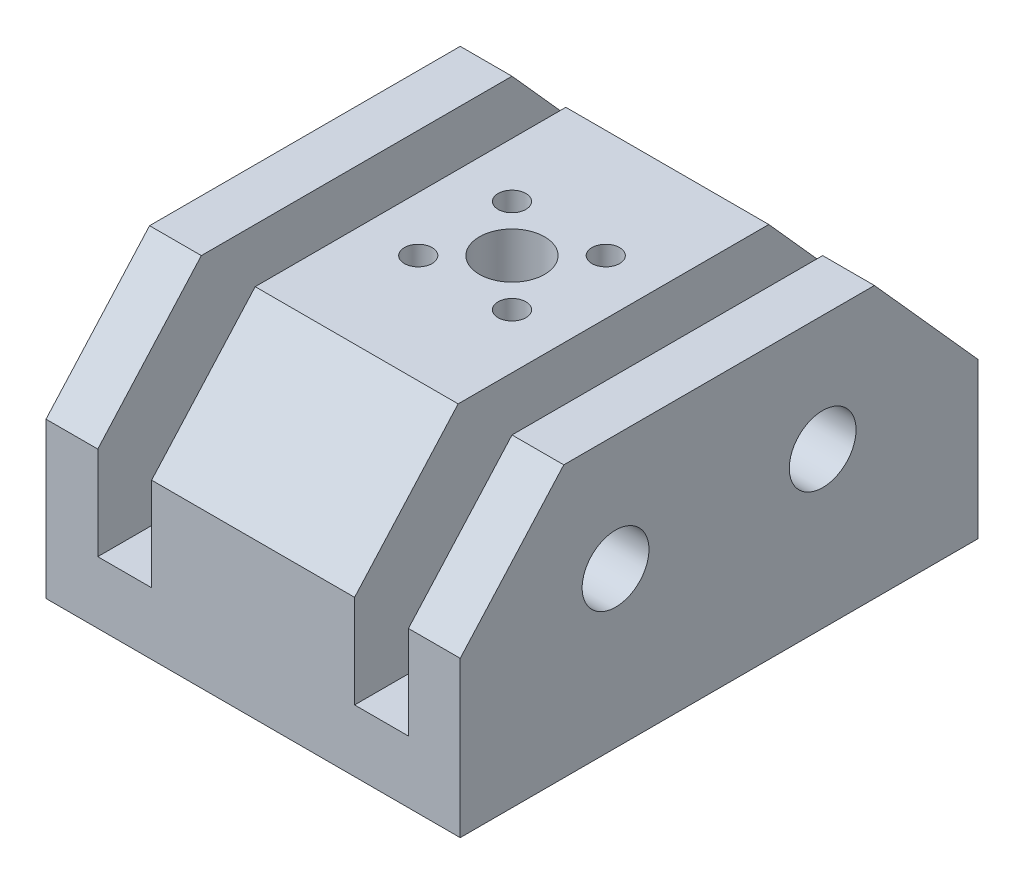
from build123d import *

# Parameters (mm, degrees)
SKETCH1_W           = 63.5
SKETCH1_H           = 6.35
BOSS_EXTRUDE1_DEPTH = 50.8
BOSS_EXTRUDE2_DEPTH = 50.8
SKETCH10_W          = 6.604
SKETCH10_H          = 25.629031657
CUT_EXTRUDE1_DEPTH  = 88.854357354
LPATTERN3_COUNT     = 2
LPATTERN3_PITCH     = 31.496
SKETCH11_R          = 4.09575
CUT_EXTRUDE2_DEPTH  = 88.854357354
CUT_EXTRUDE7_REACH  = 89.854
SKETCH21_R          = 1.700000029
SKETCH22_R          = 11
CUT_EXTRUDE8_DEPTH  = 3
SKETCH24_R          = 4
CUT_EXTRUDE10_DEPTH = 88.854357354


with BuildPart() as part:
    # Sketch1 → Boss-Extrude1 (new body)
    with BuildSketch(Plane(origin=(0, 0, 0), x_dir=(0, 0, -1), z_dir=(1, 0, 0))):
        with Locations((31.75, 3.175)):
            Rectangle(SKETCH1_W, SKETCH1_H)
    extrude(amount=-BOSS_EXTRUDE1_DEPTH)

    # Sketch2 → Boss-Extrude2 (add)
    with BuildSketch(Plane(origin=(0, 0, 0), x_dir=(0, 0, -1), z_dir=(1, 0, 0))):
        Polygon((0, 6.35), (0, 19.05), (12.7, 33.249031657), (50.8, 33.249031657), (63.5, 19.05), (63.5, 6.35), align=None)
    extrude(amount=-BOSS_EXTRUDE2_DEPTH)

    # Sketch10 → Cut-Extrude1 (cut, through all)
    with BuildSketch(Plane(origin=(0, 0, -63.5), x_dir=(-1, 0, 0), z_dir=(0, 0, -1))):
        with Locations((9.652, 20.434515829)):
            Rectangle(SKETCH10_W, SKETCH10_H)
    cut_extrude1 = extrude(amount=-CUT_EXTRUDE1_DEPTH, mode=Mode.SUBTRACT)

    # LPattern3: Cut-Extrude1 ×2
    with Locations(*[(-i * LPATTERN3_PITCH, 0, 0) for i in range(1, LPATTERN3_COUNT)]):
        add(cut_extrude1, mode=Mode.SUBTRACT)

    # Sketch11 → Cut-Extrude2 (cut, through all)
    with BuildSketch(Plane(origin=(0, 0, 0), x_dir=(0, 0, -1), z_dir=(1, 0, 0))):
        with Locations((19.05, 19.05)):
            Circle(SKETCH11_R)
        with Locations((44.45, 19.05)):
            Circle(SKETCH11_R)
    extrude(amount=-CUT_EXTRUDE2_DEPTH, mode=Mode.SUBTRACT)

    # Sketch21 → Cut-Extrude7 (cut, up to next)
    with BuildSketch(Plane.XZ, mode=Mode.PRIVATE) as cut_extrude7_sk1:
        with Locations((-31.15, -37.49999993)):
            Circle(SKETCH21_R)
    cut_extrude7_tool1 = extrude(cut_extrude7_sk1.sketch, amount=-CUT_EXTRUDE7_REACH, mode=Mode.PRIVATE) & part.part
    # Sketch21 → Cut-Extrude7 (cut, up to next)
    with BuildSketch(Plane.XZ, mode=Mode.PRIVATE) as cut_extrude7_sk2:
        with Locations((-31.14999993, -26)):
            Circle(SKETCH21_R)
    cut_extrude7_tool2 = extrude(cut_extrude7_sk2.sketch, amount=-CUT_EXTRUDE7_REACH, mode=Mode.PRIVATE) & part.part
    # Sketch21 → Cut-Extrude7 (cut, up to next)
    with BuildSketch(Plane.XZ, mode=Mode.PRIVATE) as cut_extrude7_sk3:
        with Locations((-19.65, -26.00000007)):
            Circle(SKETCH21_R)
    cut_extrude7_tool3 = extrude(cut_extrude7_sk3.sketch, amount=-CUT_EXTRUDE7_REACH, mode=Mode.PRIVATE) & part.part
    # Sketch21 → Cut-Extrude7 (cut, up to next)
    with BuildSketch(Plane.XZ, mode=Mode.PRIVATE) as cut_extrude7_sk4:
        with Locations((-19.65000007, -37.5)):
            Circle(SKETCH21_R)
    cut_extrude7_tool4 = extrude(cut_extrude7_sk4.sketch, amount=-CUT_EXTRUDE7_REACH, mode=Mode.PRIVATE) & part.part
    add(cut_extrude7_tool1.solids().sort_by_distance((-31.15, 0, -37.5))[0], mode=Mode.SUBTRACT)
    add(cut_extrude7_tool2.solids().sort_by_distance((-31.15, 0, -26))[0], mode=Mode.SUBTRACT)
    add(cut_extrude7_tool3.solids().sort_by_distance((-19.65, 0, -26))[0], mode=Mode.SUBTRACT)
    add(cut_extrude7_tool4.solids().sort_by_distance((-19.65, 0, -37.5))[0], mode=Mode.SUBTRACT)

    # Sketch22 → Cut-Extrude8 (cut)
    with BuildSketch(Plane.XZ):
        with Locations((-25.4, -31.75)):
            Circle(SKETCH22_R)
    extrude(amount=-CUT_EXTRUDE8_DEPTH, mode=Mode.SUBTRACT)

    # Sketch24 → Cut-Extrude10 (cut, through all)
    with BuildSketch(Plane.XZ):
        with Locations((-25.4, -31.75)):
            Circle(SKETCH24_R)
    extrude(amount=-CUT_EXTRUDE10_DEPTH, mode=Mode.SUBTRACT)


solid = part.part
